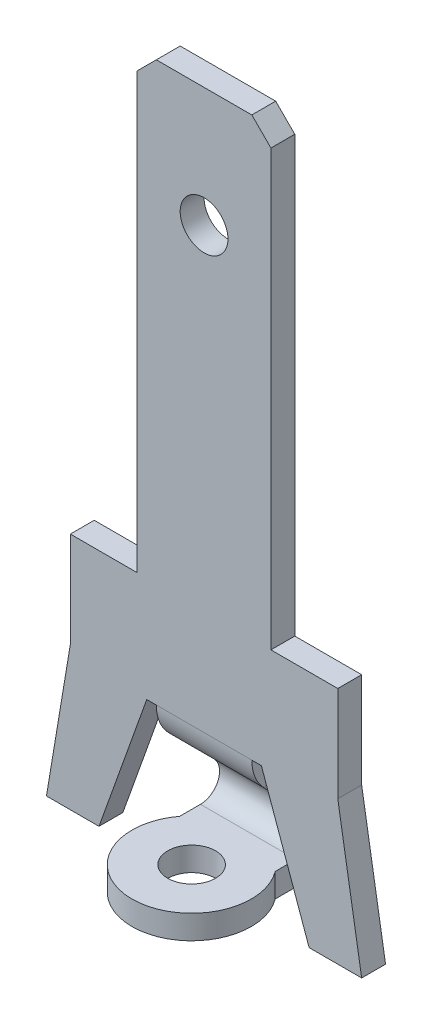
from build123d import *

# Parameters (mm, degrees)
MAINBODYS_W                           = 2.8
MAINBODYS_H                           = 0.5
MAIN_BODY_DEPTH                       = 9.5
BOTTOM_OF_MAIN_BODY_REACH             = 11.606
BOTTOM_OF_MAIN_BODY_DIRECTION_2_REACH = 11.606
TOPHOLES_R                            = 0.5
TOP_HOLE_DEPTH                        = 11.069260152
F_45_DEGREE_FLANGE_DEPTH              = 2
BOTTOM_FLAT_FLANGE_DEPTH              = 2
EXTENDEDBOTTOMFLANGES_W               = 2
EXTENDEDBOTTOMFLANGES_H               = 0.5
EXTENDED_BOTTOM_FLANGE_DEPTH          = 0.4
BOSSEDCYLINDERBODYS_R                 = 0.5
BOSSED_CYLINDER_BODY_DEPTH            = 0.5
C_MAIN_BODY_SIZE                      = 0.4


# Sheet-metal steps are written as plain solids
with BuildPart() as part:
    # MainBodyS → MAIN BODY (new body)
    with BuildSketch(Plane(origin=(0, 0, 0), x_dir=(1, 0, 0), z_dir=(0, 1, 0))):
        Rectangle(MAINBODYS_W, MAINBODYS_H)
    extrude(amount=MAIN_BODY_DEPTH)

    # BOTTOM OF MAIN BODY: up to this face of the body (flat: up to its plane)
    bottom_of_main_body_end = Plane(part.part.faces().sort_by_distance((0, 4.75, 0.25))[0])
    # BottomMainBodyS → BOTTOM OF MAIN BODY (add, up to the picked face)
    with BuildSketch(Plane.XY, mode=Mode.PRIVATE) as bottom_of_main_body_sk1:
        Polygon((0, 0), (2.8, 0), (2.8, -2), (3.3, -5), (2.2, -5), (1.2, -2.2), (0, -2.2), align=None)
    bottom_of_main_body_tool1 = split(extrude(bottom_of_main_body_sk1.sketch, amount=BOTTOM_OF_MAIN_BODY_REACH, mode=Mode.PRIVATE), bisect_by=bottom_of_main_body_end, keep=Keep.BOTH, mode=Mode.PRIVATE)
    bottom_of_main_body = bottom_of_main_body_tool1.solids().sort_by(Axis((1.768001, -2.02309, 0), (0, 0, 1)))[0]
    add(bottom_of_main_body)

    # BOTTOM OF MAIN BODY direction 2: up to this face of the body (flat: up to its plane)
    bottom_of_main_body_direction_2_end = Plane(part.part.faces().sort_by_distance((0, 4.75, -0.25))[0])
    # BottomMainBodyS → BOTTOM OF MAIN BODY direction 2 (add, up to the picked face)
    with BuildSketch(Plane.XY, mode=Mode.PRIVATE) as bottom_of_main_body_direction_2_sk1:
        Polygon((0, 0), (2.8, 0), (2.8, -2), (3.3, -5), (2.2, -5), (1.2, -2.2), (0, -2.2), align=None)
    bottom_of_main_body_direction_2_tool1 = split(extrude(bottom_of_main_body_direction_2_sk1.sketch, amount=-BOTTOM_OF_MAIN_BODY_DIRECTION_2_REACH, mode=Mode.PRIVATE), bisect_by=bottom_of_main_body_direction_2_end, keep=Keep.BOTH, mode=Mode.PRIVATE)
    bottom_of_main_body_direction_2 = bottom_of_main_body_direction_2_tool1.solids().sort_by(Axis((1.768001, -2.02309, 0), (0, 0, -1)))[0]
    add(bottom_of_main_body_direction_2)

    # BMB HM: BOTTOM OF MAIN BODY, BOTTOM OF MAIN BODY direction 2 across plane
    add(bottom_of_main_body.mirror(Plane(origin=(0, 0, 0), x_dir=(0, 0, 1), z_dir=(1, 0, 0))))
    add(bottom_of_main_body_direction_2.mirror(Plane(origin=(0, 0, 0), x_dir=(0, 0, 1), z_dir=(1, 0, 0))))

    # TopHoleS → TOP HOLE (cut, through all)
    with BuildSketch(Plane.XY.offset(0.25)):
        with Locations((0, 7)):
            Circle(TOPHOLES_R)
    extrude(amount=-TOP_HOLE_DEPTH, mode=Mode.SUBTRACT)

    # 45 DEGREE FLANGE section (across the edge) → 45 DEGREE FLANGE (add)
    with BuildSketch(Plane(origin=(1, -2.365685425, -0.25), x_dir=(0, 0.7071067811865438, -0.7071067811865512), z_dir=(-1, 0, 0))):
        with BuildLine():
            Line((-0.5, 0.165685425), (-0.5, 1.5))
            Line((-0.5, 1.5), (0, 1.5))
            Line((0, 1.5), (0, 0.165685425))
            ThreePointArc((0, 0.165685425), (0.030448187, 0.012612052), (0.117157288, -0.117157288))
            Line((0.117157288, -0.117157288), (-0.236396103, -0.470710678))
            ThreePointArc((-0.236396103, -0.470710678), (-0.431491579, -0.178729664), (-0.5, 0.165685425))
        make_face()
    extrude(amount=F_45_DEGREE_FLANGE_DEPTH)

    # BOTTOM FLAT FLANGE section (across the edge) → BOTTOM FLAT FLANGE (add)
    with BuildSketch(Plane(origin=(-1, -4.4627417, -1.639949494), x_dir=(0, 1, 0), z_dir=(1, 0, 0))):
        with BuildLine():
            Line((-0.5, 0.965685425), (-0.5, 1))
            Line((-0.5, 1), (0, 1))
            Line((0, 1), (0, 0.965685425))
            ThreePointArc((0, 0.965685425), (0.246926627, 0.596133612), (0.682842712, 0.682842712))
            Line((0.682842712, 0.682842712), (1.036396103, 0.329289322))
            ThreePointArc((1.036396103, 0.329289322), (0.055584911, 0.134193846), (-0.5, 0.965685425))
        make_face()
    extrude(amount=BOTTOM_FLAT_FLANGE_DEPTH)

    # ExtendedBottomFlangeS → EXTENDED BOTTOM FLANGE (add)
    with BuildSketch(Plane.XY.offset(-0.639949494)):
        with Locations((0, -4.7127417)):
            Rectangle(EXTENDEDBOTTOMFLANGES_W, EXTENDEDBOTTOMFLANGES_H)
    extrude(amount=EXTENDED_BOTTOM_FLANGE_DEPTH)

    # BossedCylinderBodyS → BOSSED  CYLINDER BODY (add)
    with BuildSketch(Plane.XZ.offset(4.9627417)):
        with BuildLine():
            Line((-1, -0.239949494), (1, -0.239949494))
            ThreePointArc((1, -0.239949494), (0, 1.760050506), (-1, -0.239949494))
        make_face()
        with Locations(Location((0, 0.510050506, 0), (0, 0, 270))):
            Circle(BOSSEDCYLINDERBODYS_R, mode=Mode.SUBTRACT)
    extrude(amount=-BOSSED_CYLINDER_BODY_DEPTH)

    # C MAIN BODY
    c_main_body_edges = [part.edges().sort_by_distance(p)[0] for p in [
        (-1.4, 9.5, 0),
        (1.4, 9.5, 0),
    ]]
    chamfer(c_main_body_edges, length=C_MAIN_BODY_SIZE)


solid = part.part
